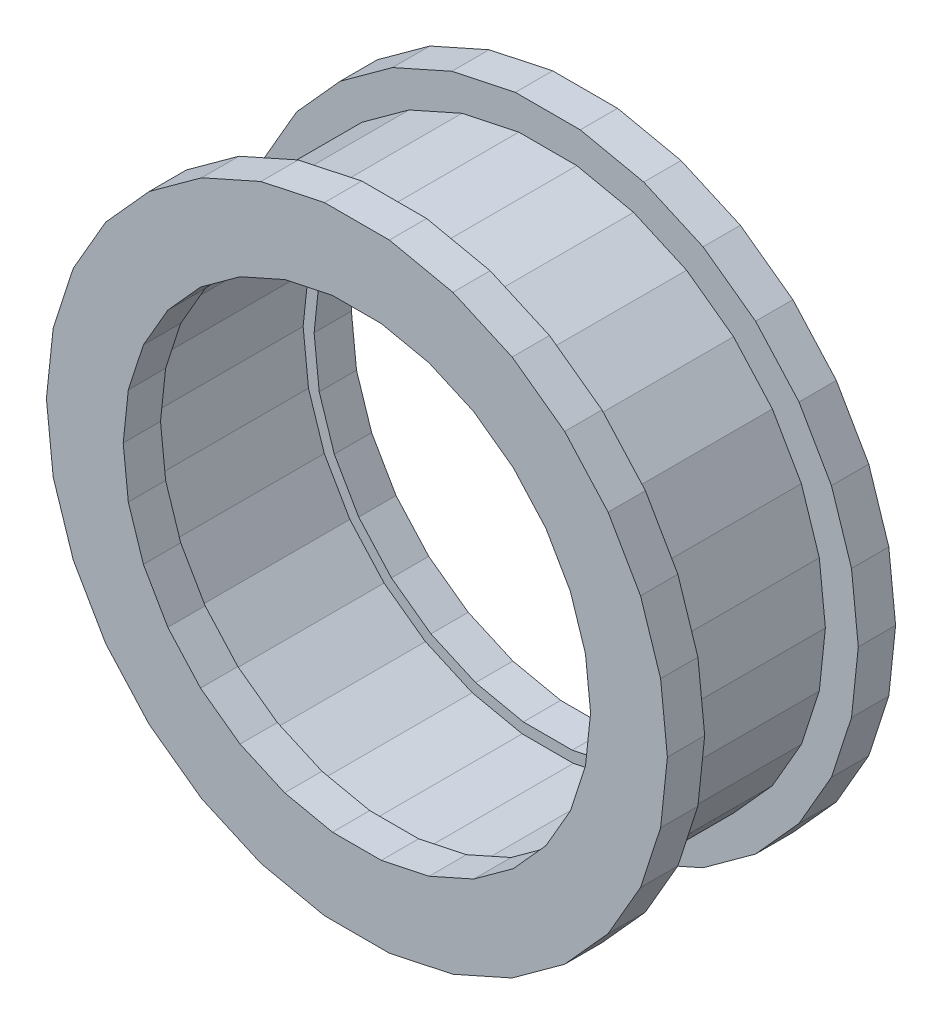
from build123d import *

# Parameters (mm, degrees)
BEARING_GUIDE_STL_DEPTH   = 1.700000048
BEARING_GUIDE_STL_START   = 1.700000048
BEARING_GUIDE_STL_2_DEPTH = 6.999999761
BEARING_GUIDE_STL_3_DEPTH = 1.700000048
BEARING_GUIDE_STL_4_DEPTH = 6.999999761
BODY_MOVE_COPY3_ANGLE     = 180


with BuildPart() as part:
    # bearing-guide.stl: read off the stored shape, not the designer's step
    # bearing-guide.stl outline → bearing-guide.stl (new body)
    with BuildSketch(Plane.XY):
        Polygon((13.840788841, -2.941950083), (14.149999619, 0), (13.840788841, 2.941950083), (12.926668167, 5.755322933), (11.447589874, 8.317160606), (9.468197823, 10.515499115), (7.074999809, 12.254259109), (4.372590065, 13.457449913), (1.479078054, 14.07248497), (-1.479078054, 14.07248497), (-4.372590065, 13.457449913), (-7.074999809, 12.254259109), (-9.468197823, 10.515499115), (-11.447589874, 8.317160606), (-12.926668167, 5.755322933), (-13.840788841, 2.941950083), (-14.149999619, 0), (-13.840788841, -2.941950083), (-12.926668167, -5.755322933), (-11.447589874, -8.317160606), (-9.468197823, -10.515499115), (-7.074999809, -12.254259109), (-4.372590065, -13.457449913), (-1.479078054, -14.07248497), (1.479078054, -14.07248497), (4.372590065, -13.457449913), (7.074999809, -12.254259109), (9.468197823, -10.515499115), (11.447589874, -8.317160606), (12.926668167, -5.755322933), align=None)
        Polygon((10.417271614, -2.214260101), (9.729258537, -4.331745148), (8.616030693, -6.259912968), (7.126241207, -7.91449213), (5.324999809, -9.223171234), (3.291030884, -10.128751755), (1.113227963, -10.591657639), (-1.113227963, -10.591657639), (-3.291030884, -10.128751755), (-5.324999809, -9.223171234), (-7.126241207, -7.91449213), (-8.616030693, -6.259912968), (-9.729258537, -4.331745148), (-10.417271614, -2.214260101), (-10.649999619, 0), (-10.417271614, 2.214260101), (-9.729258537, 4.331745148), (-8.616030693, 6.259912968), (-7.126241207, 7.91449213), (-5.324999809, 9.223171234), (-3.291030884, 10.128751755), (-1.113227963, 10.591657639), (1.113227963, 10.591657639), (3.291030884, 10.128751755), (5.324999809, 9.223171234), (7.126241207, 7.91449213), (8.616030693, 6.259912968), (9.729258537, 4.331745148), (10.417271614, 2.214260101), (10.649999619, 0), align=None, mode=Mode.SUBTRACT)
    extrude(amount=BEARING_GUIDE_STL_DEPTH)

    # bearing-guide.stl 2 outline → bearing-guide.stl 2 (add)
    with BuildSketch(Plane.XY.offset(BEARING_GUIDE_STL_START)):
        Polygon((11.493233681, -2.442961931), (11.75, 0), (11.493233681, 2.442961931), (10.73415947, 4.779156208), (9.505949974, 6.906476974), (7.862285137, 8.731951714), (5.875, 10.175798416), (3.630949974, 11.17491436), (1.228209019, 11.685631752), (-1.228209019, 11.685631752), (-3.630949974, 11.17491436), (-5.875, 10.175798416), (-7.862285137, 8.731951714), (-9.505949974, 6.906476974), (-10.73415947, 4.779156208), (-11.493233681, 2.442961931), (-11.75, 0), (-11.493233681, -2.442961931), (-10.73415947, -4.779156208), (-9.505949974, -6.906476974), (-7.862285137, -8.731951714), (-5.875, -10.175798416), (-3.630949974, -11.17491436), (-1.228209019, -11.685631752), (1.228209019, -11.685631752), (3.630949974, -11.17491436), (5.875, -10.175798416), (7.862285137, -8.731951714), (9.505949974, -6.906476974), (10.73415947, -4.779156208), align=None)
        Polygon((10.906346321, -2.318214893), (10.186032295, -4.535113811), (9.020539284, -6.553805828), (7.460805893, -8.286065102), (5.574999809, -9.656183243), (3.445538998, -10.604280472), (1.165492058, -11.088918686), (-1.165492058, -11.088918686), (-3.445538998, -10.604280472), (-5.574999809, -9.656183243), (-7.460805893, -8.286065102), (-9.020539284, -6.553805828), (-10.186032295, -4.535113811), (-10.906346321, -2.318214893), (-11.149999619, 0), (-10.906346321, 2.318214893), (-10.186032295, 4.535113811), (-9.020539284, 6.553805828), (-7.460805893, 8.286065102), (-5.574999809, 9.656183243), (-3.445538998, 10.604280472), (-1.165492058, 11.088918686), (1.165492058, 11.088918686), (3.445538998, 10.604280472), (5.574999809, 9.656183243), (7.460805893, 8.286065102), (9.020539284, 6.553805828), (10.186032295, 4.535113811), (10.906346321, 2.318214893), (11.149999619, 0), align=None, mode=Mode.SUBTRACT)
    extrude(amount=BEARING_GUIDE_STL_2_DEPTH)


with BuildPart() as body_2:
    # bearing-guide.stl 3 outline → bearing-guide.stl 3 (new body)
    with BuildSketch(Plane.XY):
        Polygon((42.840789795, -2.941950083), (43.150001526, 0), (42.840789795, 2.941950083), (41.92666626, 5.755322933), (40.447589874, 8.317160606), (38.468196869, 10.515499115), (36.075000763, 12.254259109), (33.372589111, 13.457449913), (30.479078293, 14.07248497), (27.520921707, 14.07248497), (24.627410889, 13.457449913), (21.924999237, 12.254259109), (19.531801224, 10.515499115), (17.552410126, 8.317160606), (16.073331833, 5.755322933), (15.159211159, 2.941950083), (14.850000381, 0), (15.159211159, -2.941950083), (16.073331833, -5.755322933), (17.552410126, -8.317160606), (19.531801224, -10.515499115), (21.924999237, -12.254259109), (24.627410889, -13.457449913), (27.520921707, -14.07248497), (30.479078293, -14.07248497), (33.372589111, -13.457449913), (36.075000763, -12.254259109), (38.468196869, -10.515499115), (40.447589874, -8.317160606), (41.92666626, -5.755322933), align=None)
        Polygon((39.41727066, -2.214260101), (38.729259491, -4.331745148), (37.616031647, -6.259912968), (36.126239777, -7.91449213), (34.325000763, -9.223171234), (32.291030884, -10.128751755), (30.113227844, -10.591657639), (27.886772156, -10.591657639), (25.708969116, -10.128751755), (23.674999237, -9.223171234), (21.873758316, -7.91449213), (20.383968353, -6.259912968), (19.270740509, -4.331745148), (18.582727432, -2.214260101), (18.350000381, 0), (18.582727432, 2.214260101), (19.270740509, 4.331745148), (20.383968353, 6.259912968), (21.873758316, 7.91449213), (23.674999237, 9.223171234), (25.708969116, 10.128751755), (27.886772156, 10.591657639), (30.113227844, 10.591657639), (32.291030884, 10.128751755), (34.325000763, 9.223171234), (36.126239777, 7.91449213), (37.616031647, 6.259912968), (38.729259491, 4.331745148), (39.41727066, 2.214260101), (39.650001526, 0), align=None, mode=Mode.SUBTRACT)
    extrude(amount=BEARING_GUIDE_STL_3_DEPTH)

    # bearing-guide.stl 4 outline → bearing-guide.stl 4 (add)
    with BuildSketch(Plane.XY.offset(BEARING_GUIDE_STL_START)):
        Polygon((41.373565674, -2.630083084), (41.650001526, 0), (41.373565674, 2.630083084), (40.556350708, 5.145218849), (39.23406601, 7.435482979), (37.464500427, 9.400781631), (35.325000763, 10.955221176), (32.909065247, 12.030864716), (30.322284698, 12.580701828), (27.677715302, 12.580701828), (25.090934753, 12.030864716), (22.674999237, 10.955221176), (20.535497665, 9.400781631), (18.765935898, 7.435482979), (17.443649292, 5.145218849), (16.626432419, 2.630083084), (16.350000381, 0), (16.626432419, -2.630083084), (17.443649292, -5.145218849), (18.765935898, -7.435482979), (20.535497665, -9.400781631), (22.674999237, -10.955221176), (25.090934753, -12.030864716), (27.677715302, -12.580701828), (30.322284698, -12.580701828), (32.909065247, -12.030864716), (35.325000763, -10.955221176), (37.464500427, -9.400781631), (39.23406601, -7.435482979), (40.556350708, -5.145218849), align=None)
        Polygon((41.049999237, 0), (40.786678314, -2.505336046), (40.008224487, -4.901176929), (38.748653412, -7.082811832), (37.063022614, -8.95489502), (35.025001526, -10.435606003), (32.723655701, -11.460230827), (30.259567261, -11.983988762), (27.740432739, -11.983988762), (25.276344299, -11.460230827), (22.975000381, -10.435606003), (20.936975479, -8.95489502), (19.251344681, -7.082811832), (17.99177742, -4.901176929), (17.213321686, -2.505336046), (16.950000763, 0), (17.213321686, 2.505336046), (17.99177742, 4.901176929), (19.251344681, 7.082811832), (20.936975479, 8.95489502), (22.975000381, 10.435606003), (25.276344299, 11.460230827), (27.740432739, 11.983988762), (30.259567261, 11.983988762), (32.723655701, 11.460230827), (35.025001526, 10.435606003), (37.063022614, 8.95489502), (38.748653412, 7.082811832), (40.008224487, 4.901176929), (40.786678314, 2.505336046), align=None, mode=Mode.SUBTRACT)
    extrude(amount=BEARING_GUIDE_STL_4_DEPTH)


with BuildPart() as body_2_1:
    # Body-Move/Copy1: moved
    add(body_2.part.moved(Location((-29, 0, 0))))


with BuildPart() as body_2_2:
    # Body-Move/Copy2: moved
    add(body_2_1.part.moved(Location((0, 0, -5.25))))


with BuildPart() as part_1:
    # Body-Move/Copy3: moved
    add(part.part.rotate(Axis((0, 0, 4.349999905), (1, 0, 0)), BODY_MOVE_COPY3_ANGLE))


with BuildPart() as part_2:
    # Body-Move/Copy4: moved
    add(part_1.part.moved(Location((0, 0, -3.55))))


solid = Compound([body_2_2.part, part_2.part])
